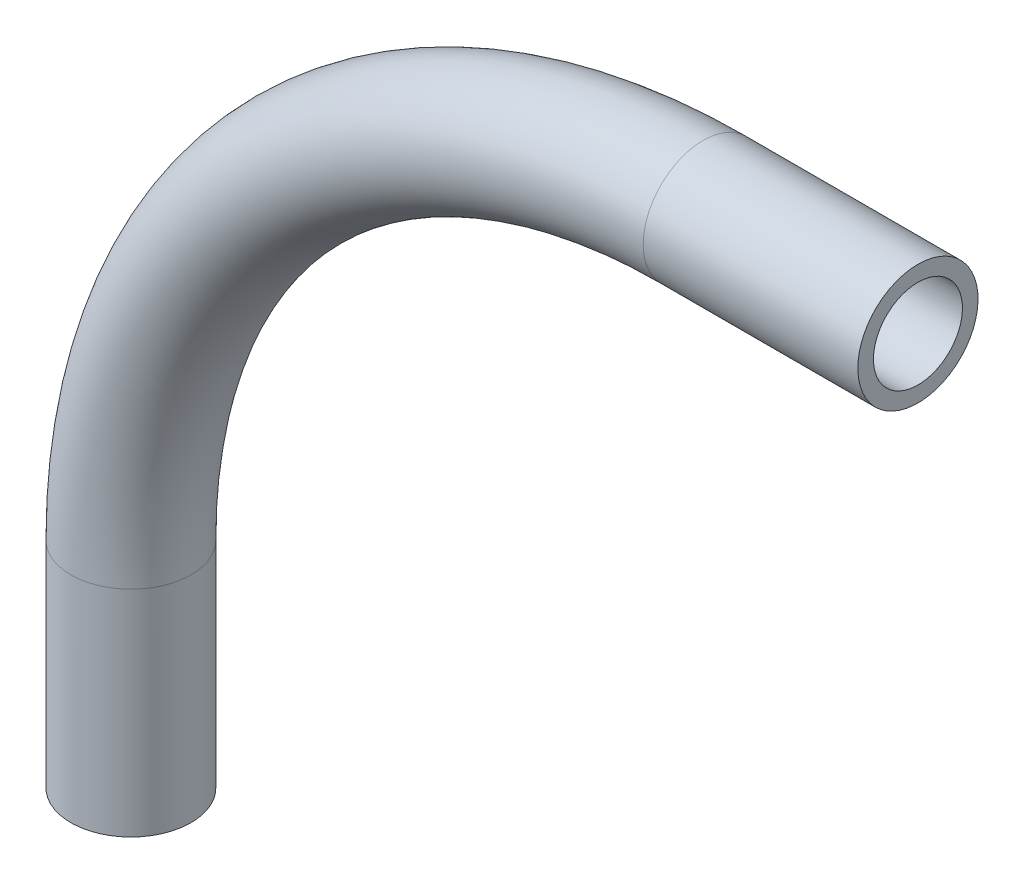
from build123d import *

# Parameters (mm, degrees)
ROUTE_R                       = 10.668
ELBOWSHELL_T                  = -2.7686
SKETCH2_R                     = 10.668
SKETCH2_R_2                   = 7.8994
ELBOWEXTENSION_EXTRUDE1_DEPTH = 38.1
SKETCH3_R                     = 10.668
SKETCH3_R_2                   = 7.8994
ELBOWEXTENSION_EXTRUDE2_DEPTH = 38.1


with BuildPart() as part:
    # Elbow: sweep along a path in ElbowArc
    with BuildLine(Plane.XY) as elbow_path:
        ThreePointArc((-101.6, 0), (-71.842048969, 71.842048969), (0, 101.6))
    # Route → Elbow (sweep)
    with BuildSketch(Plane(origin=(0, 0, 0), x_dir=(1, 0, 0), z_dir=(0, 1, 0))):
        with Locations((-101.6, 0)):
            Circle(ROUTE_R)
    sweep(path=elbow_path.line)

    # ElbowShell
    elbowshell_openings = [part.faces().sort_by_distance(p)[0] for p in [
        (0, 101.6, 0),
        (-101.6, 0, 0),
    ]]
    offset(amount=ELBOWSHELL_T, openings=elbowshell_openings, kind=Kind.INTERSECTION)

    # Sketch2 → ElbowExtension-Extrude1 (add)
    with BuildSketch(Plane(origin=(0, 0, 0), x_dir=(0, 0, -1), z_dir=(1, 0, 0))):
        with Locations((0, 101.6)):
            Circle(SKETCH2_R)
        with Locations((0, 101.6)):
            Circle(SKETCH2_R_2, mode=Mode.SUBTRACT)
    extrude(amount=ELBOWEXTENSION_EXTRUDE1_DEPTH)

    # Sketch3 → ElbowExtension-Extrude2 (add)
    with BuildSketch(Plane.XZ):
        with Locations((-101.6, 0)):
            Circle(SKETCH3_R)
        with Locations((-101.6, 0)):
            Circle(SKETCH3_R_2, mode=Mode.SUBTRACT)
    extrude(amount=ELBOWEXTENSION_EXTRUDE2_DEPTH)


solid = part.part
